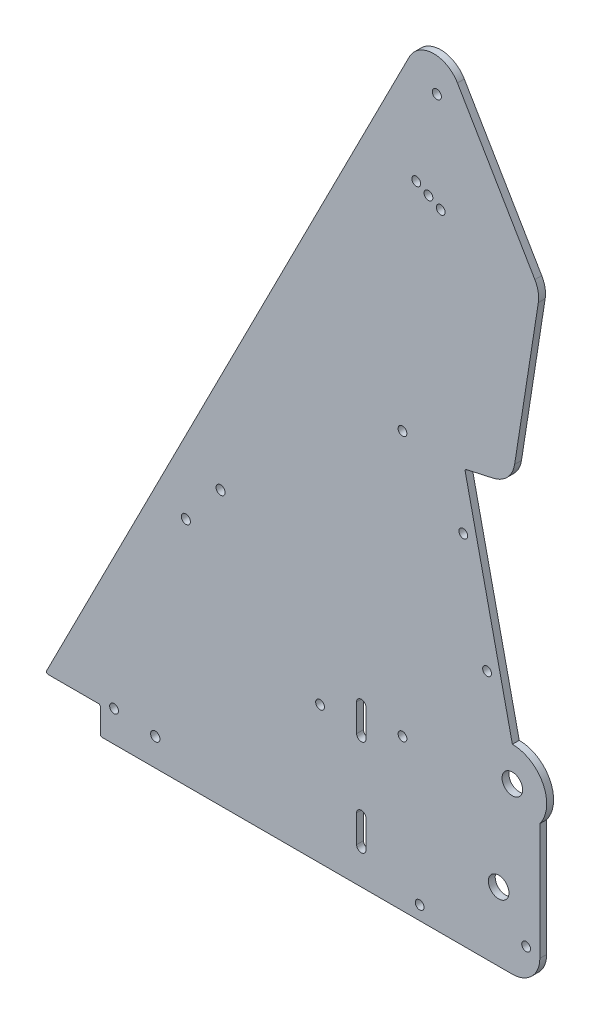
from build123d import *

# Parameters (mm, degrees)
BOSS_EXTRUDE1_DEPTH = 3.175
SKETCH2_R           = 2.0955
SKETCH2_R_2         = 2.032
SKETCH2_R_3         = 4.7625
CUT_EXTRUDE1_DEPTH  = 421.976111717
SKETCH7_R           = 2.159
CUT_EXTRUDE2_DEPTH  = 421.976111717
CUT_EXTRUDE3_REACH  = 422.976
SKETCH10_R          = 2.032
FILLET1_R           = 12.7
FILLET2_R           = 0.79375
SKETCH12_R          = 2.032
CUT_EXTRUDE5_DEPTH  = 410.593447353


with BuildPart() as part:
    # Sketch1 → Boss-Extrude1 (new body)
    with BuildSketch(Plane.XY):
        with BuildLine():
            Line((228.6, -12.7), (228.6, 53.975))
            ThreePointArc((228.6, 53.975), (230.099031657, 70.599515829), (215.9, 79.375))
            Line((215.9, 79.375), (193.909735224, 178.566674323))
            Line((193.909735224, 178.566674323), (215.607913982, 183.377044743))
            Line((215.607913982, 183.377044743), (228.6, 266.7))
            Line((228.6, 266.7), (178.754725958, 351.413083686))
            Line((178.754725958, 351.413083686), (0, 0))
            Line((0, 0), (25.4, 0))
            Line((25.4, 0), (25.4, -12.7))
            Line((25.4, -12.7), (228.6, -12.7))
        make_face()
    extrude(amount=BOSS_EXTRUDE1_DEPTH)

    # Sketch2 → Cut-Extrude1 (cut, through all)
    with BuildSketch(Plane.XY.offset(3.175)):
        with Locations((64.943150167, 94.057839899)):
            Circle(SKETCH2_R)
        with Locations((180.975, 322.164313376)):
            Circle(SKETCH2_R)
        with Locations((81.00705334, 113.73297687)):
            Circle(SKETCH2_R)
        with Locations((193.207821773, 152.394364194)):
            Circle(SKETCH2_R_2)
        with Locations((215.9, 63.5)):
            Circle(SKETCH2_R_3)
        with Locations((173.0375, -6.35)):
            Circle(SKETCH2_R_2)
        with Locations((204.202954161, 102.798527032)):
            Circle(SKETCH2_R_2)
        with Locations((209.55, 19.05)):
            Circle(SKETCH2_R_3)
        with Locations((165.1, 179.3875)):
            Circle(SKETCH2_R_2)
        with Locations((182.769678626, 276.816972924)):
            Circle(SKETCH2_R_2)
        with Locations((177.109839313, 279.695986462)):
            Circle(SKETCH2_R_2)
        with Locations((171.45, 282.575)):
            Circle(SKETCH2_R_2)
    extrude(amount=-CUT_EXTRUDE1_DEPTH, mode=Mode.SUBTRACT)

    # Sketch7 → Cut-Extrude2 (cut, through all)
    with BuildSketch(Plane.XY.offset(3.175)):
        with Locations((50.8, 0)):
            Circle(SKETCH7_R)
        with BuildLine():
            Line((143.891, 3.175), (143.891, 15.875))
            ThreePointArc((143.891, 15.875), (146.05, 18.034), (148.209, 15.875))
            Line((148.209, 15.875), (148.209, 3.175))
            ThreePointArc((148.209, 3.175), (146.05, 1.016), (143.891, 3.175))
        make_face()
        with BuildLine():
            Line((143.891, 47.625), (143.891, 60.325))
            ThreePointArc((143.891, 60.325), (146.05, 62.484), (148.209, 60.325))
            Line((148.209, 60.325), (148.209, 47.625))
            ThreePointArc((148.209, 47.625), (146.05, 45.466), (143.891, 47.625))
        make_face()
    extrude(amount=-CUT_EXTRUDE2_DEPTH, mode=Mode.SUBTRACT)

    # Sketch10 → Cut-Extrude3 (cut, up to next)
    with BuildSketch(Plane.XY.offset(3.175), mode=Mode.PRIVATE) as cut_extrude3_sk1:
        with Locations((165.1, 57.15)):
            Circle(SKETCH10_R)
    cut_extrude3_tool1 = extrude(cut_extrude3_sk1.sketch, amount=-CUT_EXTRUDE3_REACH, mode=Mode.PRIVATE) & part.part
    # Sketch10 → Cut-Extrude3 (cut, up to next)
    with BuildSketch(Plane.XY.offset(3.175), mode=Mode.PRIVATE) as cut_extrude3_sk2:
        with Locations((127, 50.8)):
            Circle(SKETCH10_R)
    cut_extrude3_tool2 = extrude(cut_extrude3_sk2.sketch, amount=-CUT_EXTRUDE3_REACH, mode=Mode.PRIVATE) & part.part
    add(cut_extrude3_tool1.solids().sort_by_distance((165.1, 57.15, 3.175))[0], mode=Mode.SUBTRACT)
    add(cut_extrude3_tool2.solids().sort_by_distance((127, 50.8, 3.175))[0], mode=Mode.SUBTRACT)

    # Fillet1
    fillet1_edges = [part.edges().sort_by_distance(p)[0] for p in [
        (228.6, -12.7, 1.5875),
        (178.754725958, 351.413083686, 1.5875),
        (215.607913982, 183.377044743, 1.5875),
        (228.6, 266.7, 1.5875),
    ]]
    fillet(fillet1_edges, radius=FILLET1_R)

    # Fillet2
    fillet2_edges = [part.edges().sort_by_distance(p)[0] for p in [
        (25.4, -12.7, 1.5875),
        (25.4, 0, 1.5875),
        (193.909735224, 178.566674323, 1.5875),
        (0, 0, 1.5875),
    ]]
    fillet(fillet2_edges, radius=FILLET2_R)

    # Sketch12 → Cut-Extrude5 (cut, through all)
    with BuildSketch(Plane.XY.offset(3.175)):
        with Locations((31.75, 1.5875)):
            Circle(SKETCH12_R)
        with Locations((222.25, 1.5875)):
            Circle(SKETCH12_R)
    extrude(amount=-CUT_EXTRUDE5_DEPTH, mode=Mode.SUBTRACT)


solid = part.part
